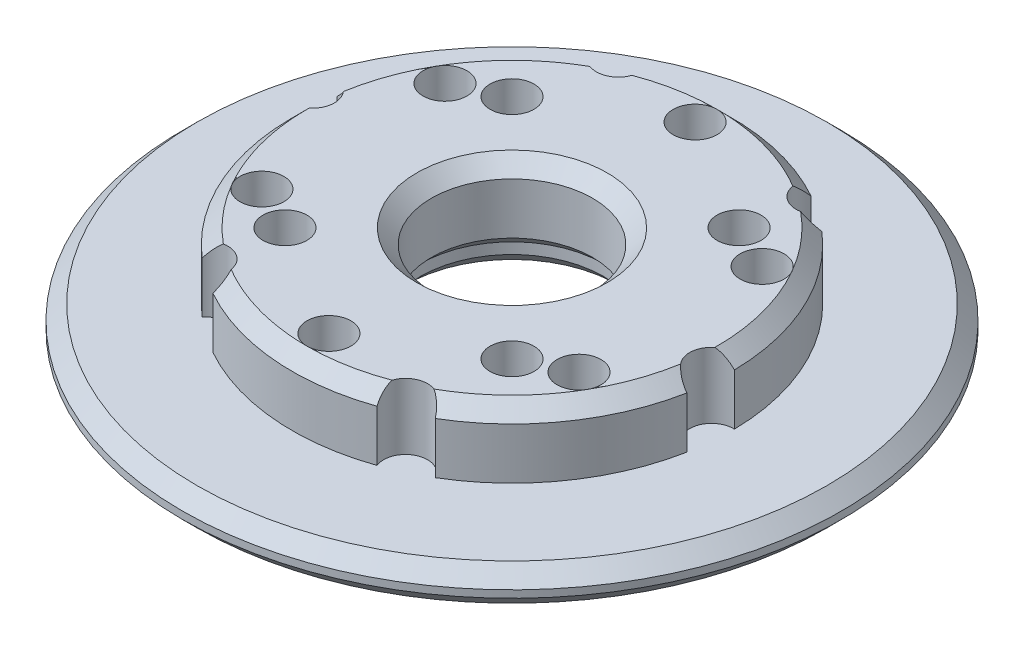
from build123d import *

# Parameters (mm, degrees)
SKETCH1_R           = 45
BOSS_EXTRUDE1_DEPTH = 5
SKETCH2_R           = 30
BOSS_EXTRUDE2_DEPTH = 9
CUT_EXTRUDE1_DEPTH  = 66.16133823057964
SKETCH4_R           = 12.5
CUT_EXTRUDE2_DEPTH  = 3
SKETCH5_R           = 11
CUT_EXTRUDE3_DEPTH  = 18.000000000000004
SKETCH10_R          = 2.9999999999999996
SKETCH10_R_2        = 2.999999999999998
SKETCH10_R_3        = 3.0000000000000004
SKETCH10_R_4        = 2.9999999999999982
SKETCH10_R_5        = 2.999999999999999
CUT_EXTRUDE4_DEPTH  = 7
SKETCH11_R          = 2.9999999999942024
SKETCH11_R_2        = 2.999999999999999
SKETCH11_R_3        = 3.000000000009364
SKETCH11_R_4        = 3.000000000013015
SKETCH11_R_5        = 3.000000000007377
SKETCH11_R_6        = 2.9999999999981304
CUT_EXTRUDE5_DEPTH  = 9
CHAMFER1_SIZE       = 2
CHAMFER2_SIZE       = 2
SKETCH12_R          = 2.999999999999999
SKETCH12_R_2        = 3.0000000000000004
CUT_EXTRUDE6_DEPTH  = 9
CHAMFER3_SIZE       = 1


with BuildPart() as part:
    # Sketch1 → Boss-Extrude1 (new body)
    with BuildSketch(Plane(origin=(0, 0, 0), x_dir=(1, 0, 0), z_dir=(0, 1, 0))):
        with Locations(Location((0, 0, 0), (0, 0, 270))):
            Circle(SKETCH1_R)
    extrude(amount=BOSS_EXTRUDE1_DEPTH)

    # Sketch2 → Boss-Extrude2 (add)
    with BuildSketch(Plane(origin=(0, 5, 0), x_dir=(1, 0, 0), z_dir=(0, 1, 0))):
        with Locations(Location((0, 0, 0), (0, 0, 270))):
            Circle(SKETCH2_R)
    extrude(amount=BOSS_EXTRUDE2_DEPTH)

    # Sketch3 → Cut-Extrude1 (cut, through all)
    with BuildSketch(Plane.XZ):
        with BuildLine():
            ThreePointArc((17.25, 15.499999999999996), (15.5, 17.249999999999996), (13.75, 15.499999999999996))
            Line((13.75, 15.499999999999996), (15.5, 15.499999999999996))
            Line((15.5, 15.499999999999996), (15.5, 13.749999999999996))
            ThreePointArc((15.499999999999975, 13.749999999999996), (16.73743686707645, 14.262563132923528), (17.25, 15.499999999999996))
        make_face()
        with BuildLine():
            Line((15.5, 15.499999999999996), (13.75, 15.499999999999996))
            ThreePointArc((13.75, 15.499999999999996), (14.262563132923532, 14.262563132923546), (15.499999999999975, 13.749999999999996))
            Line((15.5, 13.749999999999996), (15.5, 15.499999999999996))
        make_face()
        with BuildLine():
            ThreePointArc((17.25, -15.500000000000004), (16.73743686707645, -14.262563132923537), (15.499999999999975, -13.750000000000005))
            Line((15.500000000000002, -13.750000000000004), (15.500000000000002, -15.500000000000004))
            Line((15.500000000000004, -15.500000000000004), (13.750000000000004, -15.500000000000004))
            ThreePointArc((13.750000000000004, -15.500000000000004), (15.500000000000002, -17.25), (17.25, -15.500000000000004))
        make_face()
        with BuildLine():
            Line((15.500000000000002, -15.500000000000004), (15.500000000000002, -13.750000000000004))
            ThreePointArc((15.499999999999975, -13.750000000000005), (14.262563132923535, -14.262563132923557), (13.750000000000004, -15.500000000000004))
            Line((13.750000000000004, -15.500000000000004), (15.500000000000004, -15.500000000000004))
        make_face()
        with BuildLine():
            ThreePointArc((-13.749999999999996, -15.500000000000004), (-14.262563132923548, -14.262563132923537), (-15.500000000000021, -13.750000000000004))
            Line((-15.499999999999996, -13.750000000000004), (-15.499999999999996, -15.500000000000004))
            Line((-15.499999999999996, -15.500000000000004), (-13.749999999999996, -15.500000000000004))
        make_face()
        with BuildLine():
            Line((-15.499999999999996, -15.500000000000004), (-15.499999999999996, -13.750000000000004))
            ThreePointArc((-15.500000000000021, -13.750000000000004), (-16.737436867076447, -16.73743686707647), (-13.749999999999996, -15.500000000000004))
            Line((-13.749999999999996, -15.500000000000004), (-15.499999999999996, -15.500000000000004))
        make_face()
        with BuildLine():
            Line((-15.5, 13.749999999999996), (-15.5, 15.499999999999996))
            Line((-15.5, 15.499999999999996), (-13.75, 15.499999999999996))
            ThreePointArc((-13.75, 15.499999999999996), (-16.73743686707645, 16.737436867076465), (-15.500000000000025, 13.749999999999996))
        make_face()
        with BuildLine():
            Line((-13.75, 15.499999999999996), (-15.5, 15.499999999999996))
            Line((-15.5, 15.499999999999996), (-15.5, 13.749999999999996))
            ThreePointArc((-15.500000000000025, 13.749999999999996), (-14.26256313292355, 14.262563132923528), (-13.75, 15.499999999999996))
        make_face()
    extrude(amount=-CUT_EXTRUDE1_DEPTH, mode=Mode.SUBTRACT)

    # Sketch4 → Cut-Extrude2 (cut)
    with BuildSketch(Plane.XZ):
        with Locations(Location((0, 0, 0), (0, 0, 270))):
            Circle(SKETCH4_R)
    extrude(amount=-CUT_EXTRUDE2_DEPTH, mode=Mode.SUBTRACT)

    # Sketch5 → Cut-Extrude3 (cut)
    with BuildSketch(Plane.XZ.offset(-3)):
        with Locations(Location((0, 0, 0), (0, 0, 270))):
            Circle(SKETCH5_R)
    extrude(amount=-CUT_EXTRUDE3_DEPTH, mode=Mode.SUBTRACT)

    # Sketch10 → Cut-Extrude4 (cut)
    with BuildSketch(Plane(origin=(0, 13.999999999999998, 0), x_dir=(1, 0, 0), z_dir=(0, 1, 0))):
        with Locations(Location((0, 25, 0), (0, 0, 270))):
            Circle(SKETCH10_R)
        with Locations(Location((21.650635094610998, 12.49999999999995, 0), (0, 0, 270))):
            Circle(SKETCH10_R_2)
        with Locations(Location((21.650635094610916, -12.500000000000105, 0), (0, 0, 270))):
            Circle(SKETCH10_R_3)
        with Locations(Location((-1.7457e-13, -25, 0), (0, 0, 270))):
            Circle(SKETCH10_R)
        with Locations(Location((-21.65063509461109, -12.499999999999801, 0), (0, 0, 270))):
            Circle(SKETCH10_R_4)
        with Locations(Location((-21.65063509461082, 12.500000000000254, 0), (0, 0, 270))):
            Circle(SKETCH10_R_5)
    extrude(amount=-CUT_EXTRUDE4_DEPTH, mode=Mode.SUBTRACT)

    # Sketch11 → Cut-Extrude5 (cut)
    with BuildSketch(Plane(origin=(0, 13.999999999999998, 0), x_dir=(1, 0, 0), z_dir=(0, 1, 0))):
        with Locations((-12.668067495255341, 27.194118223159318)):
            Circle(SKETCH11_R)
        with Locations((17.216763467146524, 24.567927379336027)):
            Circle(SKETCH11_R_2)
        with Locations((29.88483096241041, -2.6261908438193853)):
            Circle(SKETCH11_R_3)
        with Locations((12.668067495272416, -27.194118223151523)):
            Circle(SKETCH11_R_4)
        with Locations((-17.216763467129454, -24.567927379328246)):
            Circle(SKETCH11_R_5)
        with Locations((-29.884830962393337, 2.626190843827188)):
            Circle(SKETCH11_R_6)
    extrude(amount=-CUT_EXTRUDE5_DEPTH, mode=Mode.SUBTRACT)

    # Chamfer1
    chamfer1_edges = [part.edges().sort_by_distance(p)[0] for p in [
        (1.378e-14, 0, -45),
        (1.378e-14, 5, -45),
    ]]
    chamfer(chamfer1_edges, length=CHAMFER1_SIZE)

    # Chamfer2
    # the kernel refuses this chamfer: 2 mm, written as the material it takes off along each edge
    with BuildSketch(Plane(origin=(0, 0, 0), x_dir=(-1.8e-16, 0, -1), z_dir=(-1, 0, 1.8e-16))) as chamfer2_piece_1:
        Polygon((12.5 + CHAMFER2_SIZE, 0), (12.5, -CHAMFER2_SIZE), (12.5, 0), align=None)
    revolve(axis=Axis((0, 0, 0), (0, -1, 0)), mode=Mode.SUBTRACT)
    with BuildSketch(Plane(origin=(0, 3, 0), x_dir=(-1.8e-16, 0, -1), z_dir=(-1, 0, 1.8e-16))) as chamfer2_piece_2_section:
        Polygon((11 + CHAMFER2_SIZE, 0), (11, -CHAMFER2_SIZE), (11, 0), align=None)
    chamfer2_piece_2 = revolve(axis=Axis((0, 3, 0), (0, -1, 0)), mode=Mode.PRIVATE)
    chamfer2_piece_2 = chamfer2_piece_2 & Plane(origin=(0, 4.240881281670706, 0), x_dir=(-1.8e-16, 0, -1), z_dir=(0, -1, 0)) * Cylinder(12.5, 52, mode=Mode.PRIVATE)
    add(chamfer2_piece_2, mode=Mode.SUBTRACT)
    with BuildSketch(Plane(origin=(0, 14, 0), x_dir=(-1.8e-16, 0, -1), z_dir=(-1, 0, 1.8e-16))) as chamfer2_piece_3:
        Polygon((11 + CHAMFER2_SIZE, 0), (11, CHAMFER2_SIZE), (11, 0), align=None)
    revolve(axis=Axis((0, 14, 0), (0, -1, 0)), mode=Mode.SUBTRACT)
    with BuildSketch(Plane(origin=(0, 14, 0), x_dir=(0.4858808835663902, 0, 0.8740250379621536), z_dir=(0.8740250379621536, 0, -0.4858808835663902))) as chamfer2_piece_4:
        Polygon((30, CHAMFER2_SIZE), (30 - CHAMFER2_SIZE, 0), (30, 0), align=None)
    revolve(axis=Axis((0, 14, 0), (0, -1, 0)), revolution_arc=68.1845697415076, mode=Mode.SUBTRACT)
    with BuildSketch(Plane(origin=(0, 14, 0), x_dir=(0.35650371691977006, 0, 0.9342939044125186), z_dir=(-0.9342939044125186, 0, 0.35650371691977006))) as chamfer2_piece_5:
        Polygon((30.000000000000004, -CHAMFER2_SIZE), (30.000000000000004 - CHAMFER2_SIZE, 0), (30.000000000000004, 0), align=None)
    revolve(axis=Axis((0, 14, 0), (0, 1, 0)), revolution_arc=68.18456974148796, mode=Mode.SUBTRACT)
    with BuildSketch(Plane(origin=(0, 14, 0), x_dir=(0.9873741142820315, 0, 0.15840567681044143), z_dir=(-0.15840567681044143, 0, 0.9873741142820315))) as chamfer2_piece_6:
        Polygon((30, -CHAMFER2_SIZE), (30 - CHAMFER2_SIZE, 0), (30, 0), align=None)
    revolve(axis=Axis((0, 14, 0), (0, 1, 0)), revolution_arc=68.18456974150509, mode=Mode.SUBTRACT)
    with BuildSketch(Plane(origin=(0, 14, 0), x_dir=(0.6308703973630067, 0, -0.7758882276017869), z_dir=(0.7758882276017869, 0, 0.6308703973630067))) as chamfer2_piece_7:
        Polygon((30, -CHAMFER2_SIZE), (30 - CHAMFER2_SIZE, 0), (30, 0), align=None)
    revolve(axis=Axis((0, 14, 0), (0, 1, 0)), revolution_arc=68.18456974154147, mode=Mode.SUBTRACT)
    with BuildSketch(Plane(origin=(0, 14, 0), x_dir=(-0.3565037169185992, 0, -0.9342939044129653), z_dir=(0.9342939044129653, 0, -0.3565037169185992))) as chamfer2_piece_8:
        Polygon((30, -CHAMFER2_SIZE), (30 - CHAMFER2_SIZE, 0), (30, 0), align=None)
    revolve(axis=Axis((0, 14, 0), (0, 1, 0)), revolution_arc=68.18456974156156, mode=Mode.SUBTRACT)
    with BuildSketch(Plane(origin=(0, 14, 0), x_dir=(-0.9873741142819215, 0, -0.15840567681112622), z_dir=(0.15840567681112622, 0, -0.9873741142819215))) as chamfer2_piece_9:
        Polygon((29.999999999999996, -CHAMFER2_SIZE), (29.999999999999996 - CHAMFER2_SIZE, 0), (29.999999999999996, 0), align=None)
    revolve(axis=Axis((0, 14, 0), (0, 1, 0)), revolution_arc=68.18456974154742, mode=Mode.SUBTRACT)

    # Sketch12 → Cut-Extrude6 (cut)
    with BuildSketch(Plane(origin=(0, 13.999999999999998, 0), x_dir=(1, 0, 0), z_dir=(0, 1, 0))):
        with Locations(Location((-15.499999999999996, 15.500000000000004, 0), (0, 0, 270))):
            Circle(SKETCH12_R)
        with Locations(Location((15.500000000000002, 15.500000000000004, 0), (0, 0, 270))):
            Circle(SKETCH12_R)
        with Locations(Location((15.5, -15.499999999999996, 0), (0, 0, 270))):
            Circle(SKETCH12_R_2)
        with Locations(Location((-15.5, -15.499999999999996, 0), (0, 0, 270))):
            Circle(SKETCH12_R)
    extrude(amount=-CUT_EXTRUDE6_DEPTH, mode=Mode.SUBTRACT)

    # Chamfer3
    chamfer3_edges = [part.edges().sort_by_distance(p)[0] for p in [
        (-15.499999999999975, 4.999999999999998, 17.249999999999996),
        (17.25, 4.999999999999998, 15.499999999999991),
        (15.50000000000003, 4.999999999999998, -17.25),
        (-17.25, 4.999999999999998, -15.500000000000004),
    ]]
    chamfer(chamfer3_edges, length=CHAMFER3_SIZE)


solid = part.part
